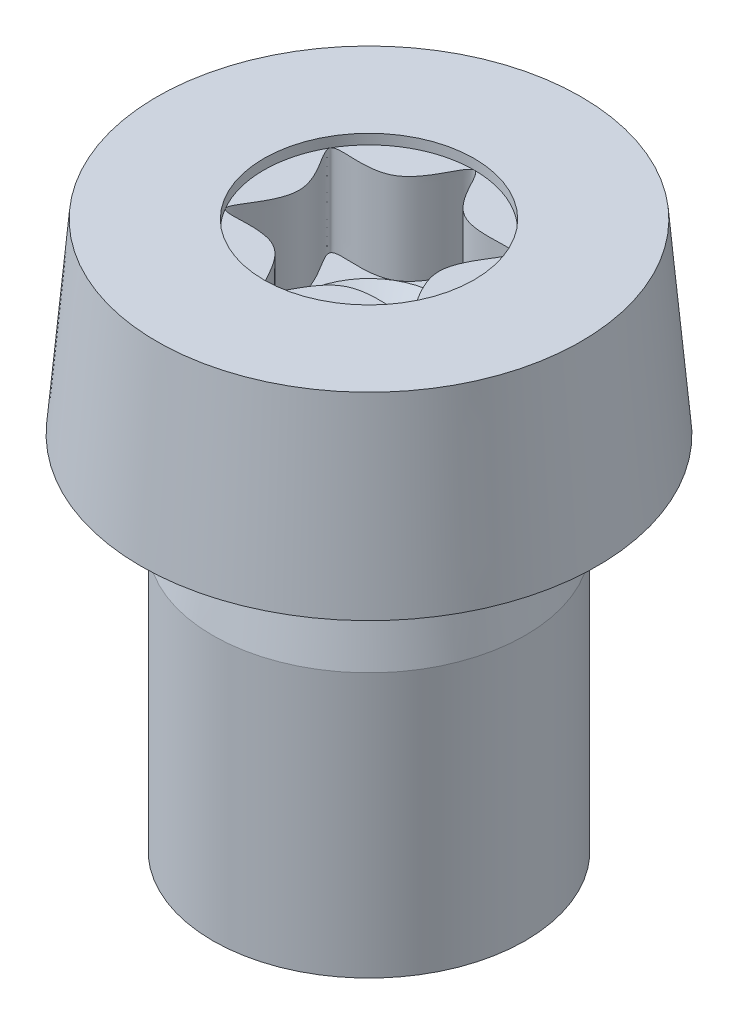
from build123d import *

# Parameters (mm, degrees)
FILLET1_R                 = 0.1
SOCKET_CUT_EXTRUDE1_DEPTH = 0.84
SKETCH3_R                 = 0.875
SOCKET_CUT_EXTRUDE2_DEPTH = 0.084


with BuildPart() as part:
    # Sketch1 → Body-Revolve (revolve)
    with BuildSketch(Plane.XY):
        Polygon((0, 4.55), (1.764392572, 4.55), (1.9, 3), (1.3, 3), (1.14, 3), (1.3, 2.2), (1.3, 0), (0, 0), align=None)
    revolve(axis=Axis((0, 0, 0), (0, 1, 0)))

    # Fillet1
    fillet1_edges = [part.edges().sort_by_distance(p)[0] for p in [
        (-1.14, 3, 0),
    ]]
    fillet(fillet1_edges, radius=FILLET1_R)

    # Sketch2 → Socket-Cut-Extrude1 (cut)
    with BuildSketch(Plane(origin=(0, 4.55, 0), x_dir=(-1, 0, 0), z_dir=(0, 1, 0))):
        with BuildLine():
            add(Edge.make_bspline(
                [(0, -0.875), (-0.062906837, -0.875), (-0.18872051, -0.326873512), (-0.99511796, -0.574531622), (-0.37744102, 0), (-0.99511796, 0.574531622), (-0.18872051, 0.326873512), (0, 1.149063244), (0.18872051, 0.326873512), (0.99511796, 0.574531622), (0.37744102, 0), (0.99511796, -0.574531622), (0.18872051, -0.326873512), (0.062906837, -0.875), (0, -0.875)],
                knots=[0, 0, 0, 0, 0.083333333, 0.166666667, 0.25, 0.333333333, 0.416666667, 0.5, 0.583333333, 0.666666667, 0.75, 0.833333333, 0.916666667, 1, 1, 1, 1], degree=3))
        make_face()
    extrude(amount=-SOCKET_CUT_EXTRUDE1_DEPTH, mode=Mode.SUBTRACT)

    # Sketch3 → Socket-Cut-Extrude2 (cut)
    with BuildSketch(Plane(origin=(0, 4.55, 0), x_dir=(-1, 0, 0), z_dir=(0, 1, 0))):
        Circle(SKETCH3_R)
    extrude(amount=-SOCKET_CUT_EXTRUDE2_DEPTH, mode=Mode.SUBTRACT)

    # Sketch4 → Drill-Cut-Revolve (revolve, cut)
    with BuildSketch(Plane.XY):
        Polygon((0, 3.71), (0.583333333, 3.71), (0, 3.155), align=None)
    revolve(axis=Axis((0, 0, 0), (0, 1, 0)), mode=Mode.SUBTRACT)


solid = part.part
